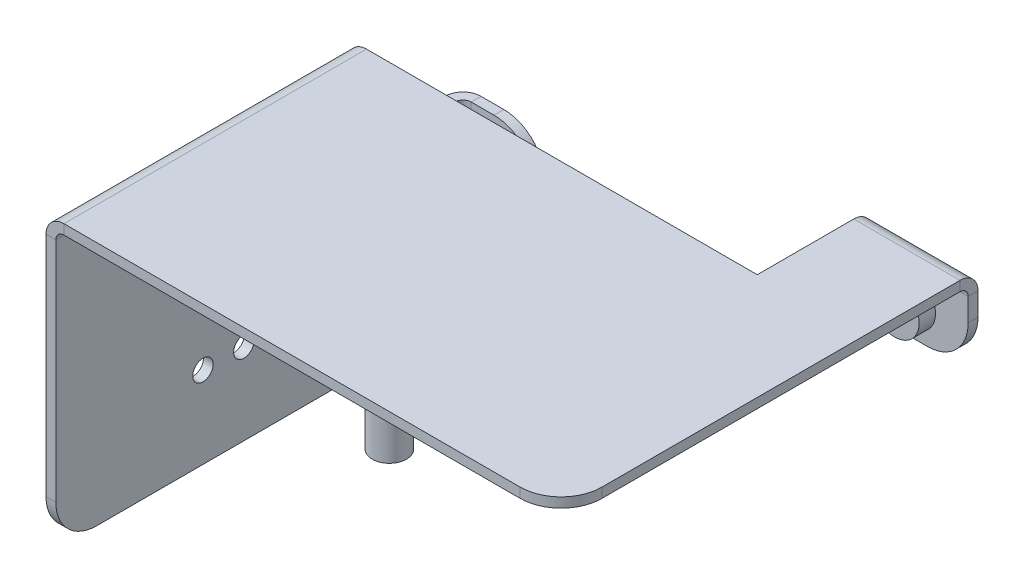
from build123d import *

# Parameters (mm, degrees)
SM_BASE_FLANGE_1_DEPTH           = 1.2
SKETCH_9_R                       = 2.1
EXTRUDE_1_DEPTH                  = 6.8
HOLE_WIZARD_M3_1_D               = 2.5
HOLE_WIZARD_M3_1_DEPTH           = 3
SM_EDGE_FLANGE_1_STRIP_W         = 6.8
SM_EDGE_FLANGE_1_STRIP_H         = 1.2
SM_EDGE_FLANGE_1_STRIP_CUT_DEPTH = 13
SM_EDGE_FLANGE_1_DEPTH           = 13
SM_EDGE_FLANGE_1_FLAT_DEPTH      = 1.2
SKETCH_15_R                      = 3
EXTRUDE_2_DEPTH                  = 2
HOLE_WIZARD_M3_2_D               = 2.5
SM_EDGE_FLANGE_4_STRIP_W         = 6.8
SM_EDGE_FLANGE_4_STRIP_H         = 1.2
SM_EDGE_FLANGE_4_STRIP_CUT_DEPTH = 37
SM_EDGE_FLANGE_4_DEPTH           = 37
SM_EDGE_FLANGE_4_FLAT_DEPTH      = 1.2
SM_EDGE_FLANGE_5_STRIP_W         = 6.8
SM_EDGE_FLANGE_5_STRIP_H         = 1.2
SM_EDGE_FLANGE_5_STRIP_CUT_DEPTH = 23
SM_EDGE_FLANGE_5_DEPTH           = 23
SM_EDGE_FLANGE_5_FLAT_DEPTH      = 1.2
SKETCH_26_R                      = 3
EXTRUDE_3_DEPTH                  = 2
HOLE_WIZARD_M3_3_D               = 2.5
CUT_EXTRUDE_1_REACH              = 78.751
SKETCH_29_R                      = 1.25


# Sheet-metal steps are written as plain solids
with BuildPart() as part:
    # Sketch 1 → 基体-法兰1 (new body)
    with BuildSketch(Plane(origin=(0, 0, 0), x_dir=(1, 0, 0), z_dir=(0, 1, 0))):
        with BuildLine():
            Line((18.5, 24.605976874), (31.5, 24.605976874))
            Line((31.5, 24.605976874), (31.5, -21.394023126))
            ThreePointArc((31.5, -21.394023126), (30.035533906, -24.929557032), (26.5, -26.394023126))
            Line((26.5, -26.394023126), (-31.5, -26.394023126))
            Line((-31.5, -26.394023126), (-31.5, 10.605976874))
            Line((-31.5, 10.605976874), (18.5, 10.605976874))
            Line((18.5, 10.605976874), (18.5, 24.605976874))
        make_face()
    extrude(amount=-SM_BASE_FLANGE_1_DEPTH)

    # 草图9 → 凸台-拉伸1 (add)
    with BuildSketch(Plane.XZ.offset(1.2)):
        with Locations(Location((-25.5, -1.605976874, 0), (0, 0, 270))):
            Circle(SKETCH_9_R)
        with Locations(Location((6.5, 22.394023126, 0), (0, 0, 270))):
            Circle(SKETCH_9_R)
        with Locations(Location((6.5, -1.605976874, 0), (0, 0, 270))):
            Circle(SKETCH_9_R)
    extrude(amount=EXTRUDE_1_DEPTH)

    # M3 螺纹孔1
    with Locations(Plane(origin=(0, -8, 0), x_dir=(-1, 0, 0), z_dir=(0, -1, 0))):
        with Locations((-6.5, 1.605976874), (25.5, 1.605976874), (-6.5, -22.394023126)):
            Hole(HOLE_WIZARD_M3_1_D / 2, depth=HOLE_WIZARD_M3_1_DEPTH)

    # 边线-法兰1 strip (across the edge) → 边线-法兰1 strip cut (cut)
    with BuildSketch(Plane(origin=(18.5, -1.2, -24.605976874), x_dir=(0, 0, 1), z_dir=(1, 0, 0))):
        with Locations((-1.2, -0.6)):
            Rectangle(SM_EDGE_FLANGE_1_STRIP_W, SM_EDGE_FLANGE_1_STRIP_H)
    extrude(amount=SM_EDGE_FLANGE_1_STRIP_CUT_DEPTH, mode=Mode.SUBTRACT)

    # 边线-法兰1 bend section (across the edge) → 边线-法兰1 (add)
    with BuildSketch(Plane(origin=(18.5, -1.2, -24.605976874), x_dir=(0, 0, 1), z_dir=(1, 0, 0))):
        with BuildLine():
            Line((0, 1), (1.2, 1))
            ThreePointArc((1.2, 1), (1.492893219, 0.292893219), (2.2, 0))
            Line((2.2, 0), (2.2, -1.2))
            ThreePointArc((2.2, -1.2), (0.644365081, -0.555634919), (0, 1))
        make_face()
    extrude(amount=SM_EDGE_FLANGE_1_DEPTH)

    # 边线-法兰1 profile (on flange) → 边线-法兰1 flat (add)
    with BuildSketch(Plane(origin=(0, -1.2, -24.605976874), x_dir=(1, 0, 0), z_dir=(0, 0, -1))):
        with BuildLine():
            Line((31.5, 1), (31.5, 3.8))
            ThreePointArc((31.5, 3.8), (30.035533906, 7.335533906), (26.5, 8.8))
            Line((26.5, 8.8), (23.5, 8.8))
            ThreePointArc((23.5, 8.8), (19.964466094, 7.335533906), (18.5, 3.8))
            Line((18.5, 3.8), (18.5, 1))
            Line((18.5, 1), (31.5, 1))
        make_face()
    extrude(amount=-SM_EDGE_FLANGE_1_FLAT_DEPTH)

    # 草图15 → 凸台-拉伸2 (add)
    with BuildSketch(Plane.XY.offset(-23.405976874)):
        with Locations((24.5, -6)):
            Circle(SKETCH_15_R)
    extrude(amount=EXTRUDE_2_DEPTH)

    # M3 螺纹孔2 (through all)
    with Locations(Plane.XY.offset(-21.405976874)):
        with Locations((24.5, -6)):
            Hole(HOLE_WIZARD_M3_2_D / 2)

    # 边线-法兰4 strip (across the edge) → 边线-法兰4 strip cut (cut)
    with BuildSketch(Plane(origin=(-31.5, -1.2, 26.394023126), x_dir=(1, 0, 0), z_dir=(0, 0, -1))):
        with Locations((-1.2, -0.6)):
            Rectangle(SM_EDGE_FLANGE_4_STRIP_W, SM_EDGE_FLANGE_4_STRIP_H)
    extrude(amount=SM_EDGE_FLANGE_4_STRIP_CUT_DEPTH, mode=Mode.SUBTRACT)

    # 边线-法兰4 bend section (across the edge) → 边线-法兰4 (add)
    with BuildSketch(Plane(origin=(-31.5, -1.2, 26.394023126), x_dir=(1, 0, 0), z_dir=(0, 0, -1))):
        with BuildLine():
            Line((0, 1), (1.2, 1))
            ThreePointArc((1.2, 1), (1.492893219, 0.292893219), (2.2, 0))
            Line((2.2, 0), (2.2, -1.2))
            ThreePointArc((2.2, -1.2), (0.644365081, -0.555634919), (0, 1))
        make_face()
    extrude(amount=SM_EDGE_FLANGE_4_DEPTH)

    # 边线-法兰4 profile (on flange) → 边线-法兰4 flat (add)
    with BuildSketch(Plane(origin=(-31.5, -1.2, 0), x_dir=(0, 0, -1), z_dir=(-1, 0, 0))):
        with BuildLine():
            Line((-26.394023126, 1), (10.605976874, 1))
            Line((10.605976874, 1), (10.605976874, 10.8))
            Line((10.605976874, 10.8), (24.605976874, 10.8))
            Line((24.605976874, 10.8), (24.605976874, 33.8))
            Line((24.605976874, 33.8), (-21.394023126, 33.8))
            ThreePointArc((-21.394023126, 33.8), (-24.929557032, 32.335533906), (-26.394023126, 28.8))
            Line((-26.394023126, 28.8), (-26.394023126, 1))
        make_face()
    extrude(amount=-SM_EDGE_FLANGE_4_FLAT_DEPTH)

    # 边线-法兰5 strip (across the edge) → 边线-法兰5 strip cut (cut)
    with BuildSketch(Plane(origin=(-30.3, -35, -24.605976874), x_dir=(0, 0, 1), z_dir=(0, 1, 0))):
        with Locations((-1.2, -0.6)):
            Rectangle(SM_EDGE_FLANGE_5_STRIP_W, SM_EDGE_FLANGE_5_STRIP_H)
    extrude(amount=SM_EDGE_FLANGE_5_STRIP_CUT_DEPTH, mode=Mode.SUBTRACT)

    # 边线-法兰5 bend section (across the edge) → 边线-法兰5 (add)
    with BuildSketch(Plane(origin=(-30.3, -35, -24.605976874), x_dir=(0, 0, 1), z_dir=(0, 1, 0))):
        with BuildLine():
            Line((0, 1), (1.2, 1))
            ThreePointArc((1.2, 1), (1.492893219, 0.292893219), (2.2, 0))
            Line((2.2, 0), (2.2, -1.2))
            ThreePointArc((2.2, -1.2), (0.644365081, -0.555634919), (0, 1))
        make_face()
    extrude(amount=SM_EDGE_FLANGE_5_DEPTH)

    # 边线-法兰5 profile (on flange) → 边线-法兰5 flat (add)
    with BuildSketch(Plane(origin=(-30.3, 0, -24.605976874), x_dir=(0, 1, 0), z_dir=(0, 0, -1))):
        with BuildLine():
            ThreePointArc((-12, 3.8), (-13.464466094, 7.335533906), (-17, 8.8))
            Line((-17, 8.8), (-30, 8.8))
            ThreePointArc((-30, 8.8), (-33.535533906, 7.335533906), (-35, 3.8))
            Line((-35, 3.8), (-35, 1))
            Line((-35, 1), (-12, 1))
            Line((-12, 1), (-12, 3.8))
        make_face()
    extrude(amount=-SM_EDGE_FLANGE_5_FLAT_DEPTH)

    # 草图26 → 凸台-拉伸3 (add)
    with BuildSketch(Plane.XY.offset(-23.405976874)):
        with Locations(Location((-25.5, -25, 0), (0, 0, 180))):
            Circle(SKETCH_26_R)
    extrude(amount=EXTRUDE_3_DEPTH)

    # M3 螺纹孔3 (through all)
    with Locations(Plane.XY.offset(-21.405976874)):
        with Locations((-25.5, -25)):
            Hole(HOLE_WIZARD_M3_3_D / 2)

    # 草图29 → 切除-拉伸1 (cut, up to next)
    with BuildSketch(Plane.ZY.offset(31.5), mode=Mode.PRIVATE) as cut_extrude_1_sk1:
        with Locations(Location((3.394023126, -25, 0), (0, 0, 270))):
            Circle(SKETCH_29_R)
    cut_extrude_1_tool1 = extrude(cut_extrude_1_sk1.sketch, amount=-CUT_EXTRUDE_1_REACH, mode=Mode.PRIVATE) & part.part
    # 草图29 → 切除-拉伸1 (cut, up to next)
    with BuildSketch(Plane.ZY.offset(31.5), mode=Mode.PRIVATE) as cut_extrude_1_sk2:
        with Locations(Location((8.394023126, -25, 0), (0, 0, 270))):
            Circle(SKETCH_29_R)
    cut_extrude_1_tool2 = extrude(cut_extrude_1_sk2.sketch, amount=-CUT_EXTRUDE_1_REACH, mode=Mode.PRIVATE) & part.part
    add(cut_extrude_1_tool1.solids().sort_by_distance((-31.5, -25, 3.394023))[0], mode=Mode.SUBTRACT)
    add(cut_extrude_1_tool2.solids().sort_by_distance((-31.5, -25, 8.394023))[0], mode=Mode.SUBTRACT)


solid = part.part
